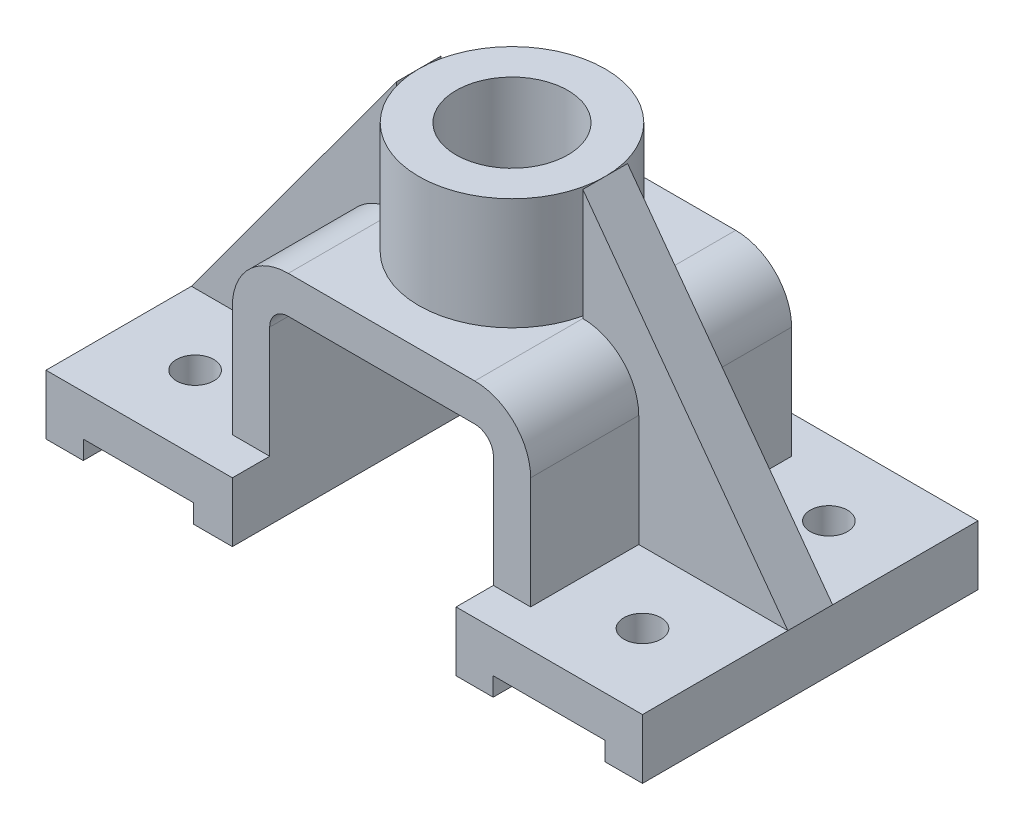
from build123d import *

# Parameters (mm, degrees)
BOSS_EXTRUDE1_DEPTH     = 45
SKETCH3_W               = 29.50841585
SKETCH3_H               = 5
SKETCH3_W_2             = 30.047341964
CUT_EXTRUDE1_DEPTH      = 155.664152278
CUT_EXTRUDE2_DEPTH      = 134.588921696
CUT_EXTRUDE2_DEPTH_BACK = 134.588921696
SKETCH4_W               = 10
SKETCH4_H               = 45
SKETCH6_R               = 25
BOSS_EXTRUDE2_DEPTH     = 30
SKETCH7_R               = 15
CUT_EXTRUDE4_DEPTH      = 150.686338722
FILLET1_R               = 15
FILLET2_R               = 5
FILLET3_R               = 15
FILLET4_R               = 5
BOSS_EXTRUDE3_DEPTH     = 6
BOSS_EXTRUDE3_2_DEPTH   = 6
CUT_EXTRUDE5_DEPTH      = 141.534693226
CUT_EXTRUDE5_DEPTH_BACK = 141.534693226
SKETCH16_R              = 5


with BuildPart() as part:
    # Sketch1 → Boss-Extrude1 (new, symmetric)
    with BuildSketch(Plane.XY):
        Polygon((0, 0), (50, 0), (50, 16), (10, 16), (10, 61), (-70, 61), (-70, 16), (-110, 16), (-110, 0), (-60, 0), (-60, 16), (-60, 51), (0, 51), (0, 3.811417612), align=None)
    extrude(amount=BOSS_EXTRUDE1_DEPTH, both=True)

    # Sketch3 → Cut-Extrude1 (cut, through all)
    with BuildSketch(Plane.XY.offset(45)):
        with Locations((-85.245792075, 2.5)):
            Rectangle(SKETCH3_W, SKETCH3_H)
        with Locations((24.976329018, 2.5)):
            Rectangle(SKETCH3_W_2, SKETCH3_H)
    extrude(amount=-CUT_EXTRUDE1_DEPTH, mode=Mode.SUBTRACT)

    # Sketch4 → Cut-Extrude2 (cut, two sides: drawn at the far end of the back side and taken through both)
    with BuildSketch(Plane(origin=(0, 0, 0), x_dir=(0, 0, -1), z_dir=(1, 0, 0)).offset(-CUT_EXTRUDE2_DEPTH_BACK)):
        with Locations((40, 38.5)):
            Rectangle(SKETCH4_W, SKETCH4_H)
        with Locations((-40, 38.5)):
            Rectangle(SKETCH4_W, SKETCH4_H)
    extrude(amount=CUT_EXTRUDE2_DEPTH + CUT_EXTRUDE2_DEPTH_BACK, mode=Mode.SUBTRACT)

    # Sketch6 → Boss-Extrude2 (add)
    with BuildSketch(Plane(origin=(0, 61, 0), x_dir=(1, 0, 0), z_dir=(0, 1, 0))):
        with Locations(Location((-30, 0, 0), (0, 0, 270))):
            Circle(SKETCH6_R)
    extrude(amount=BOSS_EXTRUDE2_DEPTH)

    # Sketch7 → Cut-Extrude4 (cut, through all)
    with BuildSketch(Plane(origin=(0, 91, 0), x_dir=(1, 0, 0), z_dir=(0, 1, 0))):
        with Locations(Location((-30, 0, 0), (0, 0, 270))):
            Circle(SKETCH7_R)
    extrude(amount=-CUT_EXTRUDE4_DEPTH, mode=Mode.SUBTRACT)

    # Fillet1
    fillet1_edges = [part.edges().sort_by_distance(p)[0] for p in [
        (-70, 61, 0),
    ]]
    fillet(fillet1_edges, radius=FILLET1_R - 0.0001)  # a hair under: the kernel refuses the full size

    # Fillet2
    fillet2_edges = [part.edges().sort_by_distance(p)[0] for p in [
        (-60, 51, 0),
    ]]
    fillet(fillet2_edges, radius=FILLET2_R)

    # Fillet3
    fillet3_edges = [part.edges().sort_by_distance(p)[0] for p in [
        (10, 61, 0),
    ]]
    fillet(fillet3_edges, radius=FILLET3_R)

    # Fillet4
    fillet4_edges = [part.edges().sort_by_distance(p)[0] for p in [
        (0, 51, 0),
    ]]
    fillet(fillet4_edges, radius=FILLET4_R)

    # Sketch16 → Cut-Extrude5 (cut, two sides: drawn at the far end of the back side and taken through both)
    with BuildSketch(Plane(origin=(0, 16, 0), x_dir=(1, 0, 0), z_dir=(0, 1, 0)).offset(-CUT_EXTRUDE5_DEPTH_BACK)):
        with Locations(Location((-90, 25, 0), (0, 0, 270))):
            Circle(SKETCH16_R)
        with Locations(Location((-90, -25, 0), (0, 0, 270))):
            Circle(SKETCH16_R)
        with Locations(Location((30, 25, 0), (0, 0, 270))):
            Circle(SKETCH16_R)
        with Locations(Location((30, -25, 0), (0, 0, 270))):
            Circle(SKETCH16_R)
    extrude(amount=CUT_EXTRUDE5_DEPTH + CUT_EXTRUDE5_DEPTH_BACK, mode=Mode.SUBTRACT)


with BuildPart() as body_2:
    # Sketch12 → Boss-Extrude3 (new, symmetric)
    with BuildSketch(Plane.XY):
        with BuildLine():
            Line((-55, 91), (-110, 16))
            Line((-110, 16), (-70, 16))
            Line((-70, 16), (-70, 46))
            ThreePointArc((-70, 46), (-65.606601718, 56.606601718), (-55, 61))
            Line((-55, 61), (-55, 91))
        make_face()
    extrude(amount=BOSS_EXTRUDE3_DEPTH, both=True)


with BuildPart() as body_3:
    # Sketch12 → Boss-Extrude3 2 (new, symmetric)
    with BuildSketch(Plane.XY):
        with BuildLine():
            Line((50, 16), (10, 16))
            Line((10, 16), (10, 46))
            ThreePointArc((10, 46), (5.606601718, 56.606601718), (-5, 61))
            Line((-5, 61), (-5, 91))
            Line((-5, 91), (50, 16))
        make_face()
    extrude(amount=BOSS_EXTRUDE3_2_DEPTH, both=True)


solid = Compound([part.part, body_2.part, body_3.part])
